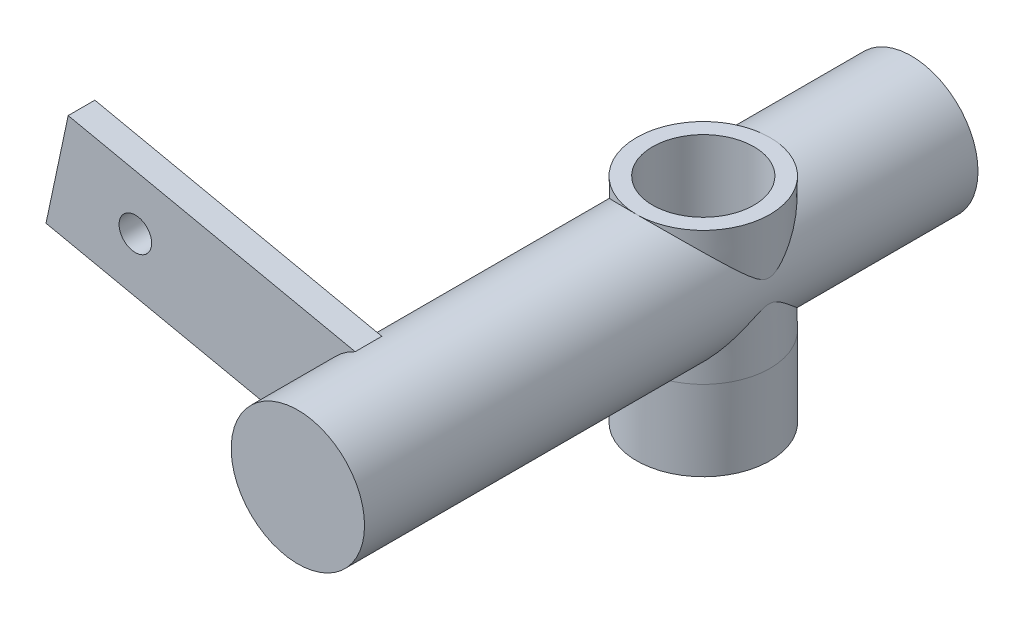
from build123d import *

# Parameters (mm, degrees)
SKETCH1_R           = 6.35
BOSS_EXTRUDE1_DEPTH = 58.42
BOSS_EXTRUDE3_START = -2.54
SKETCH7_W           = 10.16
SKETCH7_H           = 2.54
BOSS_EXTRUDE3_DEPTH = 27.94
SKETCH11_R          = 1.5499969
CUT_EXTRUDE2_DEPTH  = 62.283366229
SKETCH12_R          = 4.826
CUT_EXTRUDE3_DEPTH  = 72.389091006


# Read off the part's stored shape, not the designer's step: Boss-Extrude2, Boss-Extrude4
with BuildPart() as part:
    # Sketch1 → Boss-Extrude1 (new body)
    with BuildSketch(Plane.XY):
        with Locations(Location((0, 0, 0), (0, 0, 180))):
            Circle(SKETCH1_R)
    extrude(amount=BOSS_EXTRUDE1_DEPTH)

    # Boss-Extrude2 outline → Boss-Extrude2 (revolve)
    with BuildSketch(Plane.XY.offset(19.812)):
        Polygon((6.35, -13.97), (6.35, -6.35), (6.257921095, -1.074803042), (0, -1.074803042), (0, -13.97), align=None)
    revolve(axis=Axis((0, 0, 19.812), (0, 1, 0)))

    # Sketch7 → Boss-Extrude3 (add)
    with BuildSketch(Plane(origin=(-6.211237265, 1.320239237, 0), x_dir=(0.20791169081776326, 0.9781476007338049, 0), z_dir=(-0.9781476007338049, 0.20791169081776326, 0)).offset(BOSS_EXTRUDE3_START)):
        with Locations((0, -49.022)):
            Rectangle(SKETCH7_W, SKETCH7_H)
    extrude(amount=BOSS_EXTRUDE3_DEPTH)

    # Sketch11 → Cut-Extrude2 (cut, through all)
    with BuildSketch(Plane.XY.offset(50.292)):
        with Locations((-23.602701606, 5.016909099)):
            Circle(SKETCH11_R)
    extrude(amount=-CUT_EXTRUDE2_DEPTH, mode=Mode.SUBTRACT)

    # Boss-Extrude4 outline → Boss-Extrude4 (revolve)
    with BuildSketch(Plane.XY.offset(19.812)):
        Polygon((0, 6.350021501), (0, 1.075341111), (6.257930487, 1.075341111), (6.350000375, 6.350021501), align=None)
    revolve(axis=Axis((0, 0, 19.812), (0, 1, 0)))

    # Sketch12 → Cut-Extrude3 (cut, through all)
    with BuildSketch(Plane.XZ.offset(13.97)):
        with Locations(Location((0, 19.812, 0), (0, 0, 270))):
            Circle(SKETCH12_R)
    extrude(amount=-CUT_EXTRUDE3_DEPTH, mode=Mode.SUBTRACT)


solid = part.part
